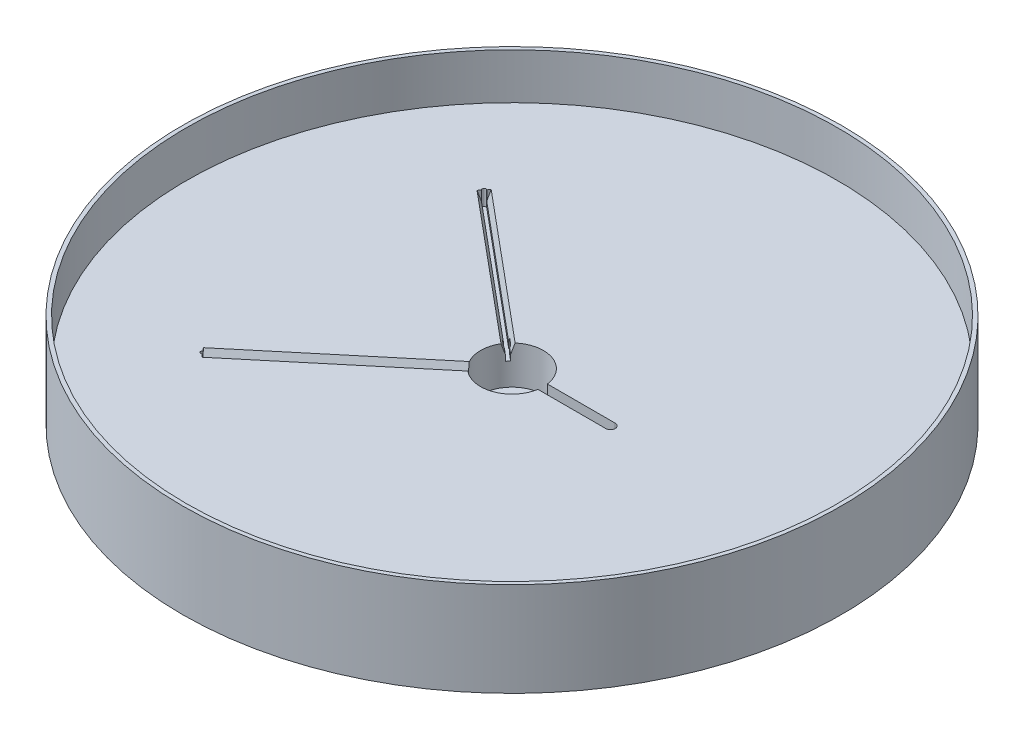
from build123d import *

# Parameters (mm, degrees)
SKETCH1_R               = 266.7
BOSS_EXTRUDE1_DEPTH     = 76.2
SKETCH2_R               = 263.525
CUT_EXTRUDE1_DEPTH      = 37.084
SKETCH3_R               = 25.4
CUT_EXTRUDE2_DEPTH      = 30.988
CUT_EXTRUDE3_DEPTH      = 380.193672753
CUT_EXTRUDE4_DEPTH      = 12.7
CUT_EXTRUDE5_DEPTH      = 6.35
CUT_EXTRUDE5_DEPTH_BACK = 152.4
CUT_EXTRUDE6_DEPTH      = 152.4
CUT_EXTRUDE6_DEPTH_BACK = 6.35
SKETCH12_W              = 4.318
SKETCH12_H              = 15.080276974
CUT_EXTRUDE10_DEPTH     = 6.35
SKETCH14_W              = 4.318
SKETCH14_H              = 12.7
CUT_EXTRUDE11_DEPTH     = 6.35


with BuildPart() as part:
    # Sketch1 → Boss-Extrude1 (new body)
    with BuildSketch(Plane(origin=(0, 0, 0), x_dir=(1, 0, 0), z_dir=(0, 1, 0))):
        Circle(SKETCH1_R)
    extrude(amount=BOSS_EXTRUDE1_DEPTH)

    # Sketch2 → Cut-Extrude1 (cut)
    with BuildSketch(Plane(origin=(0, 76.2, 0), x_dir=(1, 0, 0), z_dir=(0, 1, 0))):
        Circle(SKETCH2_R)
    extrude(amount=-CUT_EXTRUDE1_DEPTH, mode=Mode.SUBTRACT)

    # Sketch3 → Cut-Extrude2 (cut)
    with BuildSketch(Plane(origin=(0, 39.116, 0), x_dir=(1, 0, 0), z_dir=(0, 1, 0))):
        Circle(SKETCH3_R)
    extrude(amount=-CUT_EXTRUDE2_DEPTH, mode=Mode.SUBTRACT)

    # Sketch4 → Cut-Extrude3 (cut, through all)
    with BuildSketch(Plane(origin=(0, 39.116, 0), x_dir=(1, 0, 0), z_dir=(0, 1, 0))):
        with BuildLine():
            Line((3.81, 3.511669421), (80.01, 3.511669421))
            ThreePointArc((80.01, 3.511669421), (83.82, -0.298330579), (80.01, -4.108330579))
            Line((80.01, -4.108330579), (3.81, -4.108330579))
            ThreePointArc((3.81, -4.108330579), (0, -0.298330579), (3.81, 3.511669421))
        make_face()
    extrude(amount=-CUT_EXTRUDE3_DEPTH, mode=Mode.SUBTRACT)

    # Sketch5 → Cut-Extrude4 (cut)
    with BuildSketch(Plane(origin=(0, 39.116, 0), x_dir=(1, 0, 0), z_dir=(0, 1, 0))):
        with BuildLine():
            ThreePointArc((-0.976485926, -1.170064629), (1.170064629, -0.976485926), (0.976485926, 1.170064629))
            Line((0.976485926, 1.170064629), (-135.531054124, 115.09342268))
            ThreePointArc((-135.531054124, 115.09342268), (-137.677604679, 114.899843977), (-137.484025976, 112.753293422))
            Line((-137.484025976, 112.753293422), (-0.976485926, -1.170064629))
        make_face()
        with BuildLine():
            ThreePointArc((-18.489457636, -17.415509074), (-19.50107715, -16.274765436), (-20.442429489, -15.075379816))
            Line((-20.442429489, -15.075379816), (-137.484025976, -112.753293422))
            ThreePointArc((-137.484025976, -112.753293422), (-137.677604679, -114.899843977), (-135.531054124, -115.09342268))
            Line((-135.531054124, -115.09342268), (-18.489457636, -17.415509074))
        make_face()
    extrude(amount=-CUT_EXTRUDE4_DEPTH, mode=Mode.SUBTRACT)

    # Sketch6 → Cut-Extrude5 (cut, two sides: drawn at the far end of the back side and taken through both)
    with BuildSketch(Plane(origin=(-19.465943562, 0, -16.245444445), x_dir=(0.6407387966858445, 0, -0.7677589429121461), z_dir=(0.7677589429121461, 0, 0.6407387966858445)).offset(-CUT_EXTRUDE5_DEPTH_BACK)):
        Polygon((0, 26.416), (-4.067147417, 39.116), (4.067147417, 39.116), align=None)
    extrude(amount=CUT_EXTRUDE5_DEPTH + CUT_EXTRUDE5_DEPTH_BACK, mode=Mode.SUBTRACT)

    # Sketch11 → Cut-Extrude6 (cut, two sides: drawn at the far end of the back side and taken through both)
    with BuildSketch(Plane(origin=(-19.465943562, 0, 16.245444445), x_dir=(0.6407387966858473, 0, 0.7677589429121437), z_dir=(-0.7677589429121437, 0, 0.6407387966858473)).offset(-CUT_EXTRUDE6_DEPTH_BACK)):
        Polygon((0, 26.416), (4.751467106, 39.116), (-4.751467106, 39.116), align=None)
    extrude(amount=CUT_EXTRUDE6_DEPTH + CUT_EXTRUDE6_DEPTH_BACK, mode=Mode.SUBTRACT)

    # Sketch12 → Cut-Extrude10 (cut)
    with BuildSketch(Plane(origin=(-24.34121285, 0, 20.314135804), x_dir=(0.6407387966858473, 0, 0.7677589429121437), z_dir=(-0.7677589429121437, 0, 0.6407387966858473))):
        with Locations((0, 33.956138487)):
            Rectangle(SKETCH12_W, SKETCH12_H)
    extrude(amount=CUT_EXTRUDE10_DEPTH, mode=Mode.SUBTRACT)

    # Sketch14 → Cut-Extrude11 (cut)
    with BuildSketch(Plane(origin=(-24.34121285, 0, -20.314135804), x_dir=(0.6407387966858445, 0, -0.7677589429121461), z_dir=(0.7677589429121461, 0, 0.6407387966858445))):
        with Locations((0, 32.766)):
            Rectangle(SKETCH14_W, SKETCH14_H)
    extrude(amount=-CUT_EXTRUDE11_DEPTH, mode=Mode.SUBTRACT)


solid = part.part
